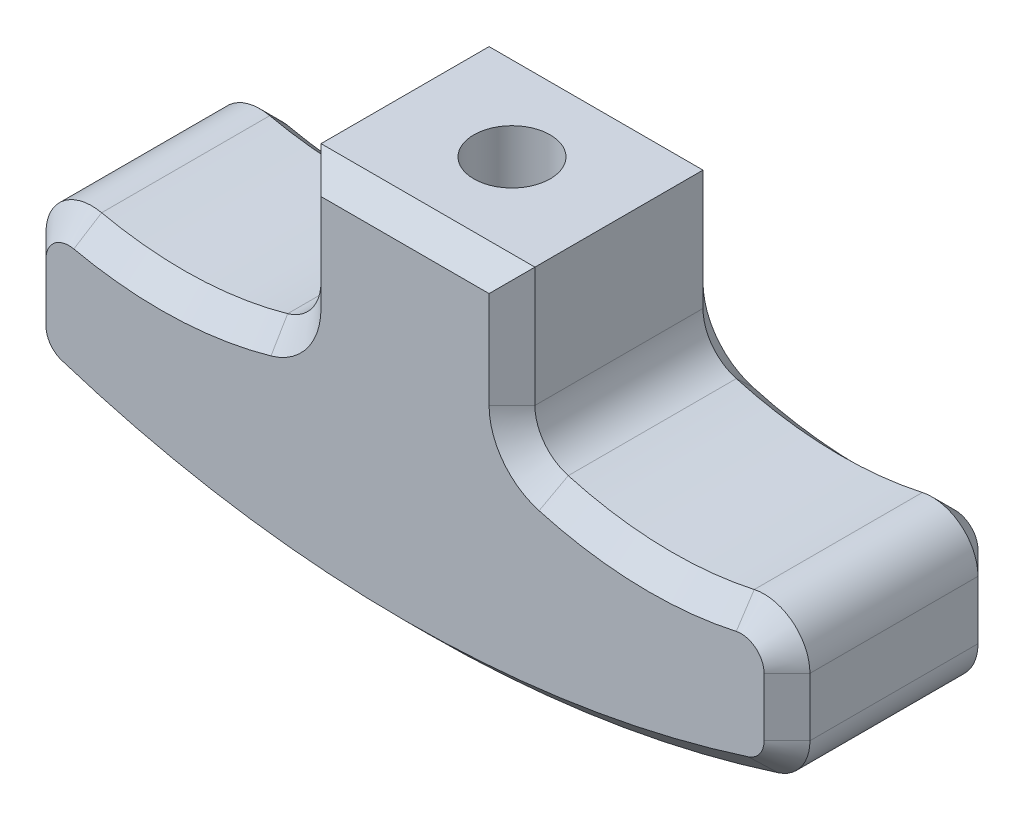
from build123d import *

# Parameters (mm, degrees)
BOSS_EXTRUDE1_DEPTH = 7
FILLET1_R           = 3
CHAMFER1_SIZE       = 1.5
SKETCH2_R           = 2.5
CUT_EXTRUDE1_DEPTH  = 36.552372037
CUT_EXTRUDE2_START  = -17
SKETCH3_R           = 5
CUT_EXTRUDE2_DEPTH  = 19.552372114


with BuildPart() as part:
    # Sketch1 → Boss-Extrude1 (new, symmetric)
    with BuildSketch(Plane.XY):
        with BuildLine():
            Line((-7, 0), (7, 0))
            Line((7, 0), (7, -10))
            ThreePointArc((7, -10), (16, -11.676192421), (25, -10))
            Line((25, -10), (25, -20))
            ThreePointArc((25, -20), (0, -24.289321881), (-25, -20))
            Line((-25, -20), (-25, -10))
            ThreePointArc((-25, -10), (-16, -11.676192421), (-7, -10))
            Line((-7, -10), (-7, 0))
        make_face()
    extrude(amount=BOSS_EXTRUDE1_DEPTH, both=True)

    # Fillet1
    fillet1_edges = [part.edges().sort_by_distance(p)[0] for p in [
        (-25, -20, 0),
        (25, -20, 0),
        (25, -10, 0),
        (7, -10, 0),
        (-7, -10, 0),
        (-25, -10, 0),
    ]]
    fillet(fillet1_edges, radius=FILLET1_R)

    # Chamfer1
    chamfer1_edges = [part.edges().sort_by_distance(p)[0] for p in [
        (24.423839929, -19.613634838, -7),
        (25, -15.935824484, -7),
        (23.880349512, -11.688199916, -7),
        (15.246787347, -11.664843259, -7),
        (7.606827894, -9.651270977, -7),
        (7, -3.921101455, -7),
        (0, 0, -7),
        (-7, -3.921101455, -7),
        (-7.606827894, -9.651270977, -7),
        (-15.246787347, -11.664843259, -7),
        (-23.880349512, -11.688199916, -7),
        (-25, -15.935824484, -7),
        (-24.423839929, -19.613634838, -7),
        (0, -24.289321881, -7),
        (-23.880349512, -11.688199916, 7),
        (-15.246787347, -11.664843259, 7),
        (-7.606827894, -9.651270977, 7),
        (-7, -3.921101455, 7),
        (0, 0, 7),
        (7, -3.921101455, 7),
        (7.606827894, -9.651270977, 7),
        (15.246787347, -11.664843259, 7),
        (23.880349512, -11.688199916, 7),
        (25, -15.935824484, 7),
        (24.423839929, -19.613634838, 7),
        (0, -24.289321881, 7),
        (-24.423839929, -19.613634838, 7),
        (-25, -15.935824484, 7),
    ]]
    chamfer(chamfer1_edges, length=CHAMFER1_SIZE)

    # Sketch2 → Cut-Extrude1 (cut, through all)
    with BuildSketch(Plane(origin=(0, 0, 0), x_dir=(1, 0, 0), z_dir=(0, 1, 0))):
        Circle(SKETCH2_R)
    extrude(amount=-CUT_EXTRUDE1_DEPTH, mode=Mode.SUBTRACT)

    # Sketch3 → Cut-Extrude2 (cut, through all)
    with BuildSketch(Plane(origin=(0, 0, 0), x_dir=(1, 0, 0), z_dir=(0, 1, 0)).offset(CUT_EXTRUDE2_START)):
        Circle(SKETCH3_R)
    extrude(amount=-CUT_EXTRUDE2_DEPTH, mode=Mode.SUBTRACT)


solid = part.part
